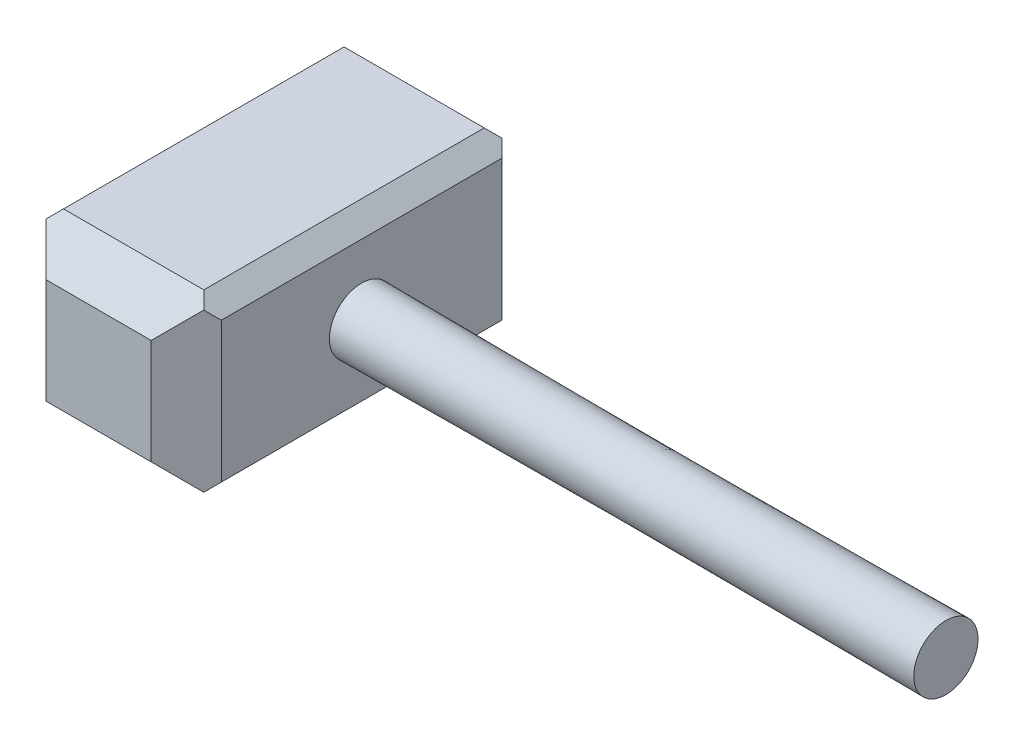
from build123d import *

# Parameters (mm, degrees)
CHAFL_N2_SIZE = 30
CHAFL_N3_SIZE = 30
CHAFL_N4_SIZE = 30
CHAFL_N5_SIZE = 15


with BuildPart() as part:
    # Croquis3 → Recubrir1 section 0
    with BuildSketch(Plane(origin=(150, 0, 0), x_dir=(0, 0, -1), z_dir=(1, 0, 0))):
        with BuildLine():
            Line((-150, 75), (150, 75))
            Line((150, 75), (150, -75))
            Line((150, -75), (-150, -75))
            Line((-150, -75), (-150, 75))
        make_face()
    # Croquis2 → Recubrir1 section 1
    with BuildSketch(Plane(origin=(0, 0, 0), x_dir=(0, 0, -1), z_dir=(1, 0, 0))):
        with BuildLine():
            Line((-150, 75), (150, 75))
            Line((150, 75), (150, -75))
            Line((150, -75), (-150, -75))
            Line((-150, -75), (-150, 75))
        make_face()
    loft()

    # Recubrir2: read off the stored shape, not the designer's step
    # Recubrir2: loft between two sections, ruled curve by curve
    recubrir2_from = [
        Edge.make_bspline([(150, 5.186927484, -27.006402635), (150, 59.199732754, -16.632547667), (150, 48.825877786, 37.380257603), (150, -5.186927484, 27.006402635), (150, -59.199732754, 16.632547667), (150, -48.825877786, -37.380257603), (150, 5.186927484, -27.006402635)], [0, 0, 0, 0, 0.5, 0.5, 0.5, 1, 1, 1, 1], 3, [1, 0.333333333, 0.333333333, 1, 0.333333333, 0.333333333, 1]),
    ]
    recubrir2_to = [
        Edge.make_bspline([(650, 19.57936818, -19.310575902), (650, 58.200519984, 19.848160458), (650, 19.041783624, 58.469312262), (650, -19.57936818, 19.310575902), (650, -58.200519984, -19.848160458), (650, -19.041783624, -58.469312262), (650, 19.57936818, -19.310575902)], [0, 0, 0, 0, 0.5, 0.5, 0.5, 1, 1, 1, 1], 3, [1, 0.333333333, 0.333333333, 1, 0.333333333, 0.333333333, 1]),
    ]
    recubrir2 = Solid(Shell([*[Face.make_surface_from_curves(recubrir2_from[k], recubrir2_to[k]) for k in range(1)], Face(Wire(recubrir2_from)), Face(Wire(recubrir2_to))]))
    add(recubrir2)

    # Recubrir4: read off the stored shape, not the designer's step
    # Recubrir4: loft between two sections, ruled curve by curve
    recubrir4_from = [
        Edge.make_bspline([(0, 44.980379665, 1.328700551), (0, 47.637780767, -88.63205878), (0, -42.322978563, -91.289459882), (0, -44.980379665, -1.328700551), (0, -47.637780767, 88.63205878), (0, 42.322978563, 91.289459882), (0, 44.980379665, 1.328700551)], [0, 0, 0, 0, 0.5, 0.5, 0.5, 1, 1, 1, 1], 3, [1, 0.333333333, 0.333333333, 1, 0.333333333, 0.333333333, 1]),
    ]
    recubrir4_to = [
        Edge.make_bspline([(-10, 44.485072203, -6.788103644), (-10, 30.908864916, -95.75824805), (-10, -58.061279491, -82.182040763), (-10, -44.485072203, 6.788103644), (-10, -30.908864916, 95.75824805), (-10, 58.061279491, 82.182040763), (-10, 44.485072203, -6.788103644)], [0, 0, 0, 0, 0.5, 0.5, 0.5, 1, 1, 1, 1], 3, [1, 0.333333333, 0.333333333, 1, 0.333333333, 0.333333333, 1]),
    ]
    recubrir4 = Solid(Shell([*[Face.make_surface_from_curves(recubrir4_from[k], recubrir4_to[k]) for k in range(1)], Face(Wire(recubrir4_from)), Face(Wire(recubrir4_to))]))
    add(recubrir4)

    # Chaflán2
    chafl_n2_edges = [part.edges().sort_by_distance(p)[0] for p in [
        (75, -75, -150),
        (75, -75, 150),
        (75, 75, -150),
        (75, 75, 150),
    ]]
    chamfer(chafl_n2_edges, length=CHAFL_N2_SIZE)

    # Chaflán3
    chafl_n3_edges = [part.edges().sort_by_distance(p)[0] for p in [
        (0, 0, 150),
    ]]
    chamfer(chafl_n3_edges, length=CHAFL_N3_SIZE)

    # Chaflán4
    chafl_n4_edges = [part.edges().sort_by_distance(p)[0] for p in [
        (150, 0, -150),
        (0, 0, -150),
        (150, 0, 150),
    ]]
    chamfer(chafl_n4_edges, length=CHAFL_N4_SIZE)

    # Chaflán5
    chafl_n5_edges = [part.edges().sort_by_distance(p)[0] for p in [
        (0, 75, 0),
        (150, 75, 0),
        (150, -75, 0),
        (0, -75, 0),
    ]]
    chamfer(chafl_n5_edges, length=CHAFL_N5_SIZE)


solid = part.part
